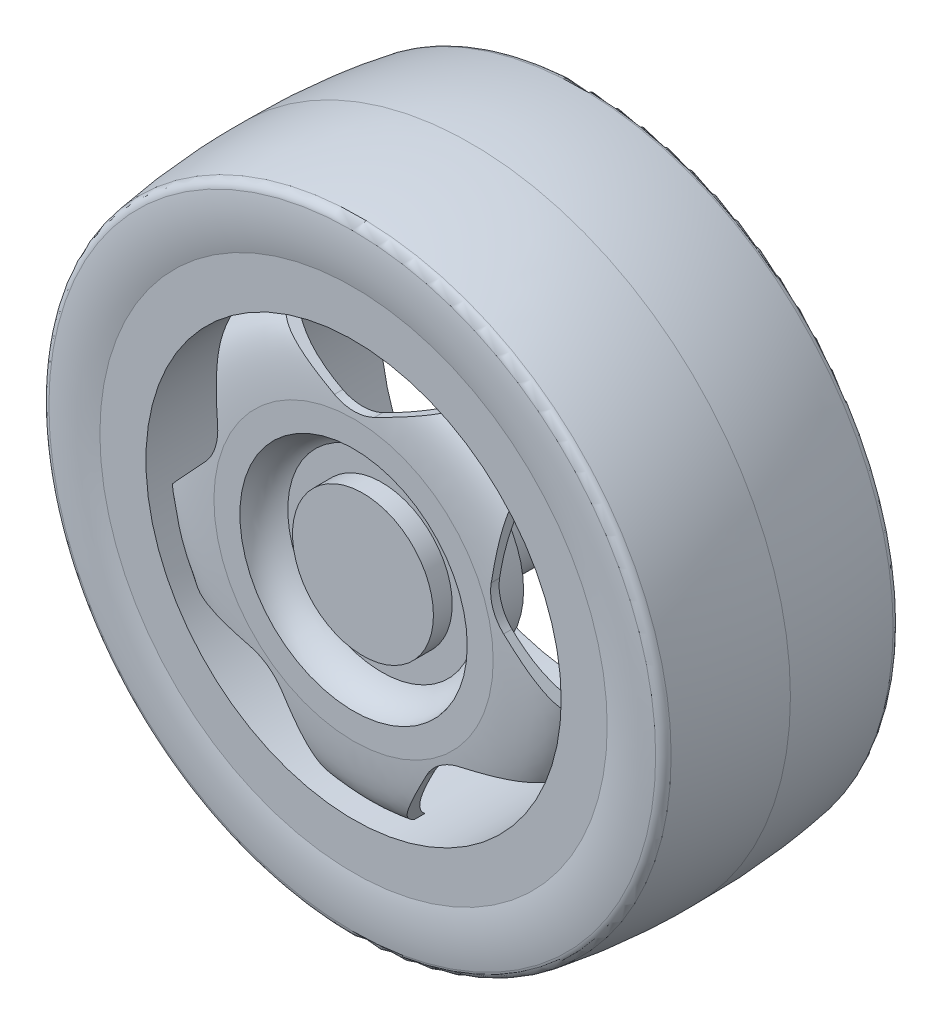
from build123d import *

# Parameters (mm, degrees)
CUT_EXTRUDE1_DEPTH  = 10
SKETCH3_R           = 6
BOSS_EXTRUDE1_DEPTH = 25
CUT_EXTRUDE2_DEPTH  = 12


with BuildPart() as part:
    # Sketch1 → Revolve1 (revolve)
    with BuildSketch(Plane(origin=(0, 0, 0), x_dir=(0, 0, -1), z_dir=(1, 0, 0))):
        with BuildLine():
            Line((-0.010712, 12.1), (-0.010712, 14.864338))
            add(Edge.make_bspline(
                [(2.989288, 22.1), (1.233895, 21.087391), (0.275128, 20.018956), (-0.010712, 14.864338)],
                knots=[0, 0, 0, 0, 1, 1, 1, 1], degree=3))
            Line((2.989288, 22.1), (-0.010712, 22.1))
            Line((-0.010712, 22.1), (-0.010712, 25.1))
            Line((-0.010712, 25.1), (24.989288, 25.1))
            Line((24.989288, 25.1), (24.989288, 22.1))
            Line((24.989288, 22.1), (4.086781, 22.1))
            ThreePointArc((4.086781, 22.1), (1.62229, 18.874187), (0.989288, 14.864338))
            Line((0.989288, 14.864338), (0.989288, 12.992036))
            ThreePointArc((0.989288, 12.992036), (2.931105, 11.902942), (4.086781, 10))
            Line((4.086781, 10), (8.086781, 10))
            Line((8.086781, 10), (8.086781, 0))
            Line((8.086781, 0), (0.989288, 0))
            Line((0.989288, 0), (0.989288, 7.5))
            Line((0.989288, 7.5), (2.989288, 7.5))
            Line((2.989288, 7.5), (2.989288, 10))
            ThreePointArc((2.989288, 10), (1.761669, 11.439115), (-0.010712, 12.1))
        make_face()
    revolve(axis=Axis((0, 0, 13.275868), (0, 0, -1)))

    # Sketch2 → Cut-Extrude1 (cut)
    with BuildSketch(Plane.XY.offset(0.010712)):
        with BuildLine():
            Line((-10, 19.70812), (-2.129814, 16.002742))
            ThreePointArc((-2.129814, 16.002742), (0, 15.526445), (2.129814, 16.002742))
            Line((2.129814, 16.002742), (10, 19.70812))
            ThreePointArc((10, 19.70812), (0, 22.1), (-10, 19.70812))
        make_face()
        with BuildLine():
            Line((15.653366, 15.600709), (14.561363, 6.970693))
            ThreePointArc((14.561363, 6.970693), (14.766527, 4.797935), (15.877661, 2.919546))
            Line((15.877661, 2.919546), (21.833706, -3.420421))
            ThreePointArc((21.833706, -3.420421), (21.018349, 6.829276), (15.653366, 15.600709))
        make_face()
        with BuildLine():
            Line((19.674312, -10.066352), (11.129231, -11.694617))
            ThreePointArc((11.129231, -11.694617), (9.126216, -12.561158), (7.68312, -14.198363))
            Line((7.68312, -14.198363), (3.493972, -21.822057))
            ThreePointArc((3.493972, -21.822057), (12.990054, -17.879276), (19.674312, -10.066352))
        make_face()
        with BuildLine():
            Line((-3.493972, -21.822057), (-7.68312, -14.198363))
            ThreePointArc((-7.68312, -14.198363), (-9.126216, -12.561158), (-11.129231, -11.694617))
            Line((-11.129231, -11.694617), (-19.674312, -10.066352))
            ThreePointArc((-19.674312, -10.066352), (-12.990054, -17.879276), (-3.493972, -21.822057))
        make_face()
        with BuildLine():
            Line((-21.833706, -3.420421), (-15.877661, 2.919546))
            ThreePointArc((-15.877661, 2.919546), (-14.766527, 4.797935), (-14.561363, 6.970693))
            Line((-14.561363, 6.970693), (-15.653366, 15.600709))
            ThreePointArc((-15.653366, 15.600709), (-21.018349, 6.829276), (-21.833706, -3.420421))
        make_face()
    extrude(amount=-CUT_EXTRUDE1_DEPTH, mode=Mode.SUBTRACT)

    # Sketch3 → Boss-Extrude1 (add)
    with BuildSketch(Plane(origin=(0, 0, -8.086781), x_dir=(-1, 0, 0), z_dir=(0, 0, -1))):
        Circle(SKETCH3_R)
    extrude(amount=BOSS_EXTRUDE1_DEPTH)

    # Sketch4 → Cut-Extrude2 (cut)
    with BuildSketch(Plane(origin=(0, 0, -33.086781), x_dir=(-1, 0, 0), z_dir=(0, 0, -1))):
        with BuildLine():
            Line((-2.547548, 2.4), (2.547548, 2.4))
            ThreePointArc((2.547548, 2.4), (3.5, 0), (2.547548, -2.4))
            Line((2.547548, -2.4), (-2.547548, -2.4))
            ThreePointArc((-2.547548, -2.4), (-3.5, 0), (-2.547548, 2.4))
        make_face()
    extrude(amount=-CUT_EXTRUDE2_DEPTH, mode=Mode.SUBTRACT)

    # Sketch5 → Revolve2 (revolve)
    with BuildSketch(Plane(origin=(0, 0, 0), x_dir=(0, 0, -1), z_dir=(1, 0, 0))):
        with BuildLine():
            Line((-0.010712, 27), (-0.010712, 24.918498))
            Line((-0.010712, 24.918498), (24.989288, 25.1))
            Line((24.989288, 25.1), (24.989288, 27))
            ThreePointArc((24.989288, 27), (25.309872, 29.640292), (25.125343, 32.293567))
            ThreePointArc((25.125343, 32.293567), (24.845231, 32.837576), (24.300645, 33.116565))
            ThreePointArc((24.300645, 33.116565), (18.414381, 33.817853), (12.489288, 34))
            ThreePointArc((12.489288, 34), (6.564195, 33.817853), (0.677932, 33.116565))
            ThreePointArc((0.677932, 33.116565), (0.133346, 32.837576), (-0.146767, 32.293567))
            ThreePointArc((-0.146767, 32.293567), (-0.331296, 29.640292), (-0.010712, 27))
        make_face()
    revolve(axis=Axis((0, 0, 0), (0, 0, -1)))


solid = part.part
